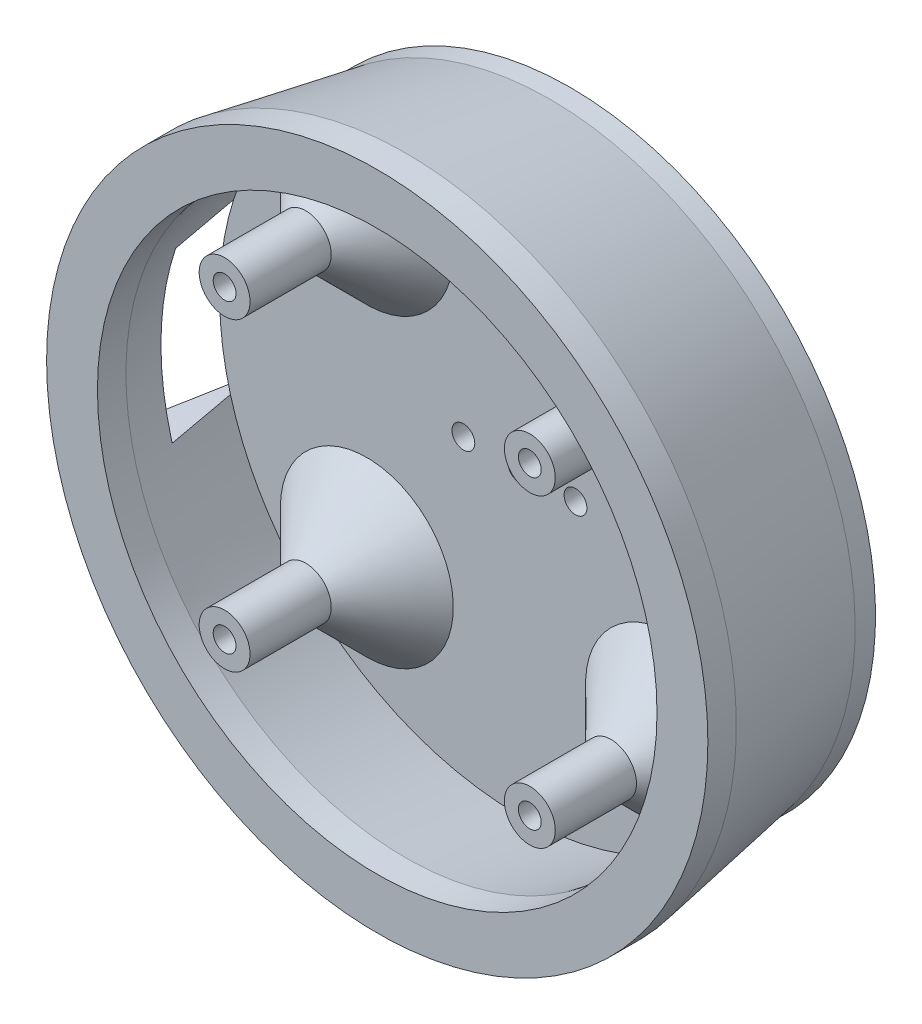
from build123d import *

# Parameters (mm, degrees)
SKETCH2_R                 = 41.27500000000001
SKETCH2_R_2               = 34.925000000000004
BOSS_EXTRUDE1_DEPTH       = 3.555999999999654
SKETCH54_R                = 41.27500000000001
SKETCH54_R_2              = 34.92500000000001
BOSS_EXTRUDE2_DEPTH       = 25.4
BOSS_EXTRUDE2_TAPER       = 10.000000000000021
BOSS_EXTRUDE3_START       = -18.006319777
BOSS_EXTRUDE3_OUTLINE_R   = 38.1
BOSS_EXTRUDE3_DEPTH       = 3.81
BOSS_EXTRUDE5_REACH       = 72.778
SKETCH63_R                = 3.175000000000002
SKETCH63_R_2              = 3.175000000000009
SKETCH63_R_3              = 3.1750000000000047
SKETCH63_R_4              = 3.1750000000000056
F_3_0MM_DOWEL_HOLE4_D     = 2.85
F_3_0MM_DOWEL_HOLE4_DEPTH = 6.858
F_3_0MM_DOWEL_HOLE3_D     = 2.9
CUT_EXTRUDE2_REACH        = 126.878
SKETCH58_W                = 12.700000000000001
SKETCH58_H                = 21.266668123278706
SKETCH60_R                = 1.4249999999999978
SKETCH60_R_2              = 1.4250000000000005
CUT_EXTRUDE4_DEPTH        = 70.71188168256496
SKETCH64_R                = 1.425000000000001
SKETCH64_R_2              = 1.4249999999999978
SKETCH64_R_3              = 1.4499999999999962
BOSS_EXTRUDE6_DEPTH       = 2.54
CHAMFER1_SIZE             = 7.62


with BuildPart() as part:
    # Sketch2 → Boss-Extrude1 (new body)
    with BuildSketch(Plane(origin=(0, 0.7215916123591171, 0), x_dir=(1, 0, 0), z_dir=(0, 0, 1))):
        with Locations((11.43, -1.4797279014976155)):
            Circle(SKETCH2_R)
        with Locations((11.43, -1.4797279014976155)):
            Circle(SKETCH2_R_2, mode=Mode.SUBTRACT)
    extrude(amount=BOSS_EXTRUDE1_DEPTH)

    # Sketch54 → Boss-Extrude2 (add)
    with BuildSketch(Plane(origin=(0, 0, 0), x_dir=(-1, 0, 0), z_dir=(0, 0, -1))):
        with Locations((-11.43, -0.7581362891384984)):
            Circle(SKETCH54_R)
        with Locations(Location((-11.43, -0.7581362891384984, 0), (0, 0, 180))):
            Circle(SKETCH54_R_2, mode=Mode.SUBTRACT)
    extrude(amount=BOSS_EXTRUDE2_DEPTH, taper=BOSS_EXTRUDE2_TAPER)

    # Boss-Extrude3: read off the stored shape, not the designer's step
    # Boss-Extrude3 outline → Boss-Extrude3 (add)
    with BuildSketch(Plane.XY.offset(BOSS_EXTRUDE3_START)):
        with Locations((11.43, -0.758136289)):
            Circle(BOSS_EXTRUDE3_OUTLINE_R)
    extrude(amount=BOSS_EXTRUDE3_DEPTH)

    # Sketch63 → Boss-Extrude5 (add, up to next)
    with BuildSketch(Plane.XY.offset(3.555999999999654), mode=Mode.PRIVATE) as boss_extrude5_sk1:
        with Locations((-7.620000000000007, 18.2918637108615)):
            Circle(SKETCH63_R)
    boss_extrude5_tool1 = extrude(boss_extrude5_sk1.sketch, amount=-BOSS_EXTRUDE5_REACH, mode=Mode.PRIVATE) - part.part
    # Sketch63 → Boss-Extrude5 (add, up to next)
    with BuildSketch(Plane.XY.offset(3.555999999999654), mode=Mode.PRIVATE) as boss_extrude5_sk2:
        with Locations((30.479999999999997, 18.291863710861506)):
            Circle(SKETCH63_R_2)
    boss_extrude5_tool2 = extrude(boss_extrude5_sk2.sketch, amount=-BOSS_EXTRUDE5_REACH, mode=Mode.PRIVATE) - part.part
    # Sketch63 → Boss-Extrude5 (add, up to next)
    with BuildSketch(Plane.XY.offset(3.555999999999654), mode=Mode.PRIVATE) as boss_extrude5_sk3:
        with Locations((30.48, -19.8081362891385)):
            Circle(SKETCH63_R_3)
    boss_extrude5_tool3 = extrude(boss_extrude5_sk3.sketch, amount=-BOSS_EXTRUDE5_REACH, mode=Mode.PRIVATE) - part.part
    # Sketch63 → Boss-Extrude5 (add, up to next)
    with BuildSketch(Plane.XY.offset(3.555999999999654), mode=Mode.PRIVATE) as boss_extrude5_sk4:
        with Locations((-7.620000000000007, -19.8081362891385)):
            Circle(SKETCH63_R_4)
    boss_extrude5_tool4 = extrude(boss_extrude5_sk4.sketch, amount=-BOSS_EXTRUDE5_REACH, mode=Mode.PRIVATE) - part.part
    add(boss_extrude5_tool1.solids().sort_by_distance((-7.62, 18.291864, 3.556))[0])
    add(boss_extrude5_tool2.solids().sort_by_distance((30.48, 18.291864, 3.556))[0])
    add(boss_extrude5_tool3.solids().sort_by_distance((30.48, -19.808136, 3.556))[0])
    add(boss_extrude5_tool4.solids().sort_by_distance((-7.62, -19.808136, 3.556))[0])

    # Ø3.0mm Dowel Hole4
    with Locations(Plane.XY.offset(3.555999999999654)):
        with Locations((-7.62, 18.291863711), (30.48, 18.291863711), (30.48, -19.808136289), (-7.62, -19.808136289)):
            Hole(F_3_0MM_DOWEL_HOLE4_D / 2, depth=F_3_0MM_DOWEL_HOLE4_DEPTH)

    # Ø3.0mm Dowel Hole3 (through all)
    with Locations(Plane(origin=(0, 0, -18.006319777286198), x_dir=(-1, 0, 0), z_dir=(0, 0, -1))):
        with Locations((-11.43, -0.758136289)):
            Hole(F_3_0MM_DOWEL_HOLE3_D / 2)

    # Cut-Extrude2: up to this cone (the profile starts outside it)
    cut_extrude2_end = Plane(origin=(11.43, -0.7581362891384984, -11.65632), z_dir=(0, 0, -1)) * Cone(7.999516737370435, 65.961130686173, 328.7166474235434, mode=Mode.PRIVATE)
    # Sketch58 → Cut-Extrude2 (cut, up to the surface)
    with BuildSketch(Plane(origin=(-63.5, 0, 0), x_dir=(0, 0, -1), z_dir=(1, 0, 0)), mode=Mode.PRIVATE) as cut_extrude2_sk1:
        with Locations((11.656319777286228, -0.08753137128510957)):
            Rectangle(SKETCH58_W, SKETCH58_H)
    cut_extrude2_tool1 = extrude(cut_extrude2_sk1.sketch, amount=CUT_EXTRUDE2_REACH, mode=Mode.PRIVATE) - cut_extrude2_end
    add(cut_extrude2_tool1.solids().sort_by_distance((-63.5, -0.087531, -11.65632))[0], mode=Mode.SUBTRACT)

    # Sketch60 → Cut-Extrude4 (cut, through all)
    with BuildSketch(Plane.XY.offset(-14.196319777286197)):
        with Locations((18.43, -0.7581362891384957)):
            Circle(SKETCH60_R)
        with Locations((4.429999999999999, -0.7581362891384984)):
            Circle(SKETCH60_R_2)
    extrude(amount=-CUT_EXTRUDE4_DEPTH, mode=Mode.SUBTRACT)

    # Sketch64 → Boss-Extrude6 (add)
    with BuildSketch(Plane(origin=(0, 0, -18.006319777286198), x_dir=(-1, 0, 0), z_dir=(0, 0, -1))):
        with BuildLine():
            ThreePointArc((25.344366452837203, -10.720865432924475), (26.663599038852283, -0.05977229582778121), (24.954487952256596, 10.545802690354252))
            ThreePointArc((24.954487952256596, 10.545802690354252), (-49.52359903885228, -1.4565002824492193), (25.344366452837203, -10.720865432924475))
        make_face()
        with Locations(Location((-4.429999999999999, -0.7581362891384984, 0), (0, 0, 180))):
            Circle(SKETCH64_R, mode=Mode.SUBTRACT)
        with Locations(Location((-18.43, -0.7581362891384957, 0), (0, 0, 180))):
            Circle(SKETCH64_R_2, mode=Mode.SUBTRACT)
        with Locations((-11.43, -0.7581362891384984)):
            Circle(SKETCH64_R_3, mode=Mode.SUBTRACT)
    extrude(amount=BOSS_EXTRUDE6_DEPTH)

    # Chamfer1
    # the kernel refuses this chamfer: 7.62 mm, written as the material it adds along each edge
    with BuildSketch(Plane(origin=(-7.620000000000007, 18.2918637108615, -14.196319777000001), x_dir=(1, 0, 0), z_dir=(0, -1, 0))) as chamfer1_piece_1:
        Polygon((3.1750000000000016 + CHAMFER1_SIZE, 0), (3.1750000000000016, CHAMFER1_SIZE), (3.1750000000000016, 0), align=None)
    revolve(axis=Axis((-7.620000000000007, 18.2918637108615, -14.196319777000001), (0, 0, 1)))
    with BuildSketch(Plane(origin=(30.479999999999997, 18.291863710861506, -14.196319777000001), x_dir=(1, 0, 0), z_dir=(0, -1, 0))) as chamfer1_piece_2:
        Polygon((3.1750000000000043 + CHAMFER1_SIZE, 0), (3.1750000000000043, CHAMFER1_SIZE), (3.1750000000000043, 0), align=None)
    revolve(axis=Axis((30.479999999999997, 18.291863710861506, -14.196319777000001), (0, 0, 1)))
    with BuildSketch(Plane(origin=(30.48, -19.8081362891385, -14.196319777000001), x_dir=(1, 0, 0), z_dir=(0, -1, 0))) as chamfer1_piece_3:
        Polygon((3.1750000000000007 + CHAMFER1_SIZE, 0), (3.1750000000000007, CHAMFER1_SIZE), (3.1750000000000007, 0), align=None)
    revolve(axis=Axis((30.48, -19.8081362891385, -14.196319777000001), (0, 0, 1)))
    with BuildSketch(Plane(origin=(-7.620000000000007, -19.8081362891385, -14.196319777000001), x_dir=(1, 0, 0), z_dir=(0, -1, 0))) as chamfer1_piece_4:
        Polygon((3.175000000000005 + CHAMFER1_SIZE, 0), (3.175000000000005, CHAMFER1_SIZE), (3.175000000000005, 0), align=None)
    revolve(axis=Axis((-7.620000000000007, -19.8081362891385, -14.196319777000001), (0, 0, 1)))


solid = part.part
